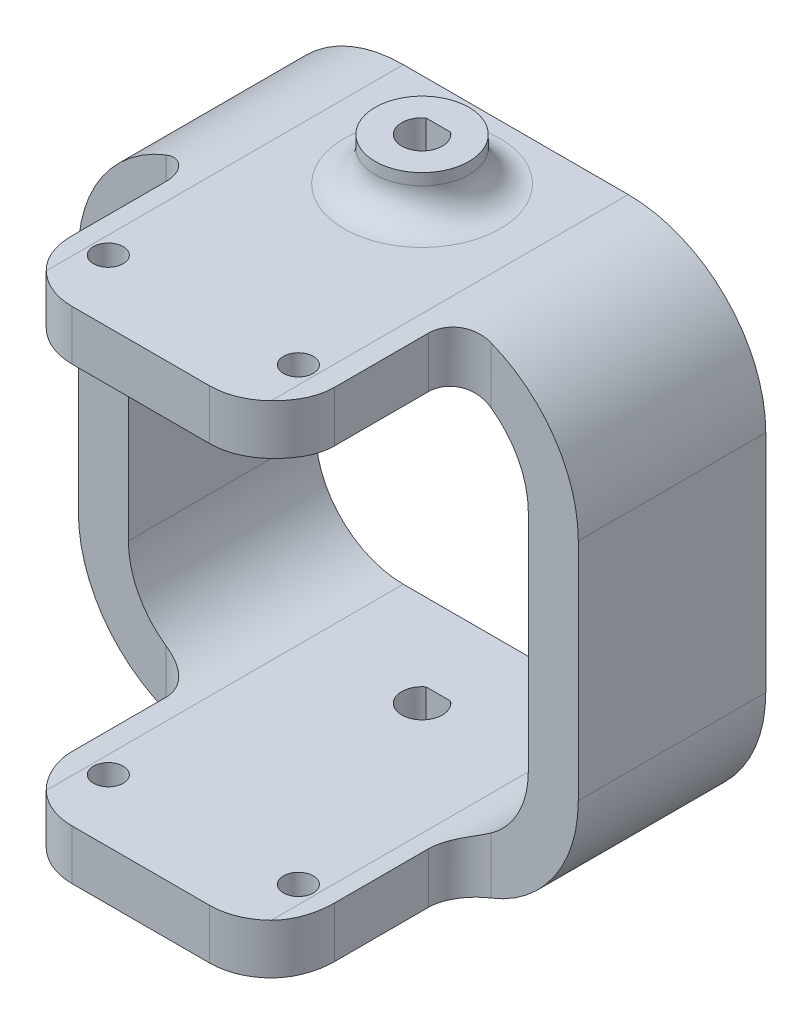
from build123d import *

# Parameters (mm, degrees)
ESQUISSE1_W                             = 80
ESQUISSE1_H                             = 80
ESQUISSE1_W_2                           = 64
ESQUISSE1_H_2                           = 64
BOSS_EXTRU_1_DEPTH                      = 15
ESQUISSE7_W                             = 42
ESQUISSE7_H                             = 8
BOSS_EXTRU_4_DEPTH                      = 30
ESQUISSE12_R                            = 7.5
BOSS_EXTRU_5_DEPTH                      = 6.84
PER_AGE_POUR_CROUS_AUTO_BLOQUANTS_300_D = 4.7625
CONG_1_R                                = 10
CONG_1_OF_SYM_TRIE2_R                   = 10
CONG_2_R                                = 22
CONG_3_R                                = 14
CONG_4_R                                = 5
ENL_V_MAT_EXTRU_3_DEPTH                 = 133.668543465


with BuildPart() as part:
    # Esquisse1 → Boss.-Extru.1 (new, symmetric)
    with BuildSketch(Plane.XY):
        Rectangle(ESQUISSE1_W, ESQUISSE1_H)
        Rectangle(ESQUISSE1_W_2, ESQUISSE1_H_2, mode=Mode.SUBTRACT)
    extrude(amount=BOSS_EXTRU_1_DEPTH, both=True)

    # Esquisse7 → Boss.-Extru.4 (add)
    with BuildSketch(Plane.XY.offset(15)):
        with Locations((0, 36)):
            Rectangle(ESQUISSE7_W, ESQUISSE7_H)
    boss_extru_4 = extrude(amount=BOSS_EXTRU_4_DEPTH)

    # Esquisse12 → Boss.-Extru.5 (add)
    with BuildSketch(Plane(origin=(0, 40, 0), x_dir=(1, 0, 0), z_dir=(0, 1, 0))):
        Circle(ESQUISSE12_R)
    boss_extru_5 = extrude(amount=BOSS_EXTRU_5_DEPTH)

    # Perçage pour écrous auto-bloquants 300® #6 (SP)1 (through all)
    with Locations(Plane(origin=(0, 40, 0), x_dir=(0, 0, -1), z_dir=(0, 1, 0))):
        with Locations((-35, -15.205), (-35, 15.205)):
            per_age_pour_crous_auto_bloquants_300 = Hole(PER_AGE_POUR_CROUS_AUTO_BLOQUANTS_300_D / 2)

    # Congé1
    cong_1_edges = [part.edges().sort_by_distance(p)[0] for p in [
        (21, 36, 45),
        (-21, 36, 45),
    ]]
    fillet(cong_1_edges, radius=CONG_1_R)

    # Symétrie2: Boss.-Extru.4, Boss.-Extru.5, Perçage pour écrous auto-bloquants 300® #6 (SP)1 across plane
    add(boss_extru_4.mirror(Plane.ZX))
    add(boss_extru_5.mirror(Plane.ZX))
    add(per_age_pour_crous_auto_bloquants_300.mirror(Plane.ZX), mode=Mode.SUBTRACT)

    # Congé1 of Symétrie2
    cong_1_of_sym_trie2_edges = [part.edges().sort_by_distance(p)[0] for p in [
        (21, -36, 45),
        (-21, -36, 45),
    ]]
    fillet(cong_1_of_sym_trie2_edges, radius=CONG_1_OF_SYM_TRIE2_R)

    # Congé2
    cong_2_edges = [part.edges().sort_by_distance(p)[0] for p in [
        (40, -40, 0),
        (-40, -40, 0),
        (-40, 40, 0),
        (40, 40, 0),
    ]]
    fillet(cong_2_edges, radius=CONG_2_R)

    # Congé3
    cong_3_edges = [part.edges().sort_by_distance(p)[0] for p in [
        (-32, 32, 0),
        (-32, -32, 0),
        (32, -32, 0),
        (32, 32, 0),
    ]]
    fillet(cong_3_edges, radius=CONG_3_R)

    # Congé4
    cong_4_edges = [part.edges().sort_by_distance(p)[0] for p in [
        (-21, -35.734644524, 15),
        (-21, 35.734644524, 15),
        (21, -35.734644524, 15),
        (21, 35.734644524, 15),
        (-7.5, -40, 0),
        (-7.5, 40, 0),
    ]]
    fillet(cong_4_edges, radius=CONG_4_R)

    # Esquisse11 → Enlèv. mat.-Extru.3 (cut, through all)
    with BuildSketch(Plane(origin=(0, -46.84, -40), x_dir=(1, 0, 0), z_dir=(0, 1, 0))):
        with BuildLine():
            Line((1.964942747, -37.405), (-1.964942747, -37.405))
            ThreePointArc((-1.964942747, -37.405), (0, -43.255), (1.964942747, -37.405))
        make_face()
    extrude(amount=ENL_V_MAT_EXTRU_3_DEPTH, mode=Mode.SUBTRACT)


solid = part.part
